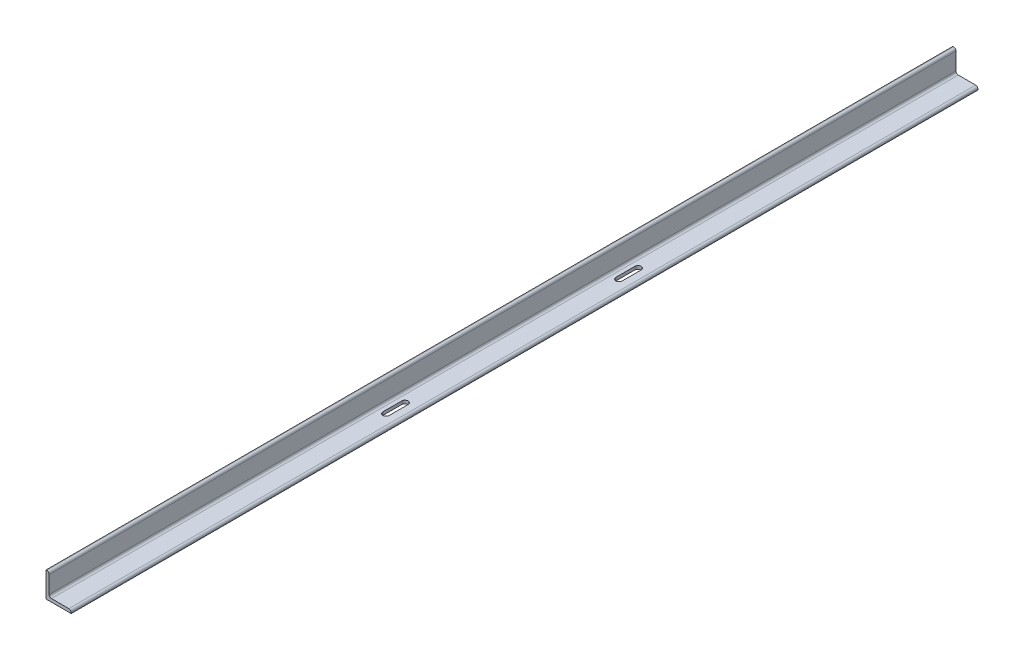
from build123d import *

# Parameters (mm, degrees)
BOSS_EXTRUDE1_DEPTH = 914.4
CUT_EXTRUDE2_REACH  = 919.218


with BuildPart() as part:
    # Sketch1 → Boss-Extrude1 (new, symmetric)
    with BuildSketch(Plane.XY):
        with BuildLine():
            Line((0, 0), (0, 50.8))
            Line((0, 50.8), (1.59258, 50.8))
            ThreePointArc((1.59258, 50.8), (4.956583943, 49.406583943), (6.35, 46.04258))
            Line((6.35, 46.04258), (6.35, 11.1125))
            ThreePointArc((6.35, 11.1125), (7.744903955, 7.744903955), (11.1125, 6.35))
            Line((11.1125, 6.35), (46.04258, 6.35))
            ThreePointArc((46.04258, 6.35), (49.406583943, 4.956583943), (50.8, 1.59258))
            Line((50.8, 1.59258), (50.8, 0))
            Line((50.8, 0), (0, 0))
        make_face()
    extrude(amount=BOSS_EXTRUDE1_DEPTH, both=True)

    # Sketch5 → Cut-Extrude2 (cut, up to next)
    with BuildSketch(Plane.XZ, mode=Mode.PRIVATE) as cut_extrude2_sk1:
        with BuildLine():
            Line((19.05, -254), (19.05, -215.9))
            ThreePointArc((19.05, -215.9), (25.4, -209.55), (31.75, -215.9))
            Line((31.75, -215.9), (31.75, -254))
            ThreePointArc((31.75, -254), (25.4, -260.35), (19.05, -254))
        make_face()
    cut_extrude2_tool1 = extrude(cut_extrude2_sk1.sketch, amount=-CUT_EXTRUDE2_REACH, mode=Mode.PRIVATE) & part.part
    # Sketch5 → Cut-Extrude2 (cut, up to next)
    with BuildSketch(Plane.XZ, mode=Mode.PRIVATE) as cut_extrude2_sk2:
        with BuildLine():
            Line((19.05, 254), (19.05, 215.9))
            ThreePointArc((19.05, 215.9), (25.4, 209.55), (31.75, 215.9))
            Line((31.75, 215.9), (31.75, 254))
            ThreePointArc((31.75, 254), (25.4, 260.35), (19.05, 254))
        make_face()
    cut_extrude2_tool2 = extrude(cut_extrude2_sk2.sketch, amount=-CUT_EXTRUDE2_REACH, mode=Mode.PRIVATE) & part.part
    add(cut_extrude2_tool1.solids().sort_by_distance((25.4, 0, -234.95))[0], mode=Mode.SUBTRACT)
    add(cut_extrude2_tool2.solids().sort_by_distance((25.4, 0, 234.95))[0], mode=Mode.SUBTRACT)


solid = part.part
